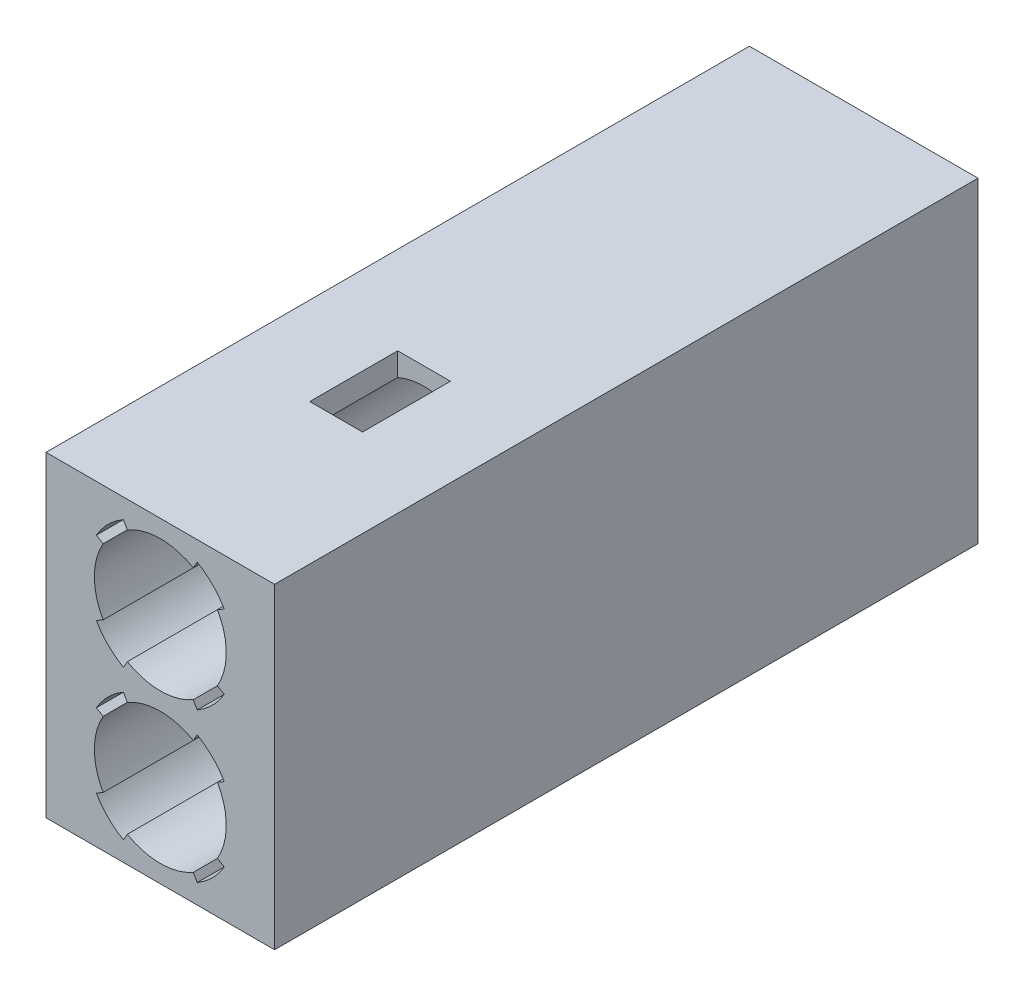
from build123d import *

# Parameters (mm, degrees)
SKETCH_1_W          = 130
SKETCH_1_H          = 180
EXTRUDE_1_DEPTH     = 400
SKETCH_2_R          = 37.5
CUT_EXTRUDE_1_DEPTH = 458.493169348
CUT_EXTRUDE_4_REACH = 459.493
SKETCH_11_W         = 30
SKETCH_11_H         = 50
CUT_EXTRUDE_9_DEPTH = 458.493169348


with BuildPart() as part:
    # 草圖1 → 填料-伸長1 (new body)
    with BuildSketch(Plane.XY):
        with Locations((-65, 90)):
            Rectangle(SKETCH_1_W, SKETCH_1_H)
    extrude(amount=EXTRUDE_1_DEPTH)

    # 草圖2 → 除料-伸長1 (cut, through all)
    with BuildSketch(Plane.XY.offset(400)):
        with Locations((-65, 132.5)):
            Circle(SKETCH_2_R)
        with Locations((-65, 47.5)):
            Circle(SKETCH_2_R)
    extrude(amount=-CUT_EXTRUDE_1_DEPTH, mode=Mode.SUBTRACT)

    # 草圖11 → 除料-伸長4 (cut, up to next)
    with BuildSketch(Plane(origin=(0, 180, 0), x_dir=(1, 0, 0), z_dir=(0, 1, 0)), mode=Mode.PRIVATE) as cut_extrude_4_sk1:
        with Locations((-65, -275)):
            Rectangle(SKETCH_11_W, SKETCH_11_H)
    cut_extrude_4_tool1 = extrude(cut_extrude_4_sk1.sketch, amount=-CUT_EXTRUDE_4_REACH, mode=Mode.PRIVATE) & part.part
    add(cut_extrude_4_tool1.solids().sort_by_distance((-65, 180, 275))[0], mode=Mode.SUBTRACT)

    # 草圖17 → 除料-伸長9 (cut, through all)
    with BuildSketch(Plane.XY.offset(400)):
        with BuildLine():
            Line((-44, 83.873066959), (-46.5, 79.54293994))
            ThreePointArc((-46.5, 79.54293994), (-38.837049096, 73.662950904), (-32.95706006, 66))
            Line((-32.95706006, 66), (-28.626933041, 68.5))
            ThreePointArc((-28.626933041, 68.5), (-35.30151519, 77.19848481), (-44, 83.873066959))
        make_face()
        with BuildLine():
            Line((-44, 168.873066959), (-46.5, 164.54293994))
            ThreePointArc((-46.5, 164.54293994), (-38.837049096, 158.662950904), (-32.95706006, 151))
            Line((-32.95706006, 151), (-28.626933041, 153.5))
            ThreePointArc((-28.626933041, 153.5), (-35.30151519, 162.19848481), (-44, 168.873066959))
        make_face()
        with BuildLine():
            Line((-28.626933041, 111.5), (-32.95706006, 114))
            ThreePointArc((-32.95706006, 114), (-38.837049096, 106.337049096), (-46.5, 100.45706006))
            Line((-46.5, 100.45706006), (-44, 96.126933041))
            ThreePointArc((-44, 96.126933041), (-35.30151519, 102.80151519), (-28.626933041, 111.5))
        make_face()
        with BuildLine():
            Line((-86, 96.126933041), (-83.5, 100.45706006))
            ThreePointArc((-83.5, 100.45706006), (-91.162950904, 106.337049096), (-97.04293994, 114))
            Line((-97.04293994, 114), (-101.373066959, 111.5))
            ThreePointArc((-101.373066959, 111.5), (-94.69848481, 102.80151519), (-86, 96.126933041))
        make_face()
        with BuildLine():
            Line((-101.373066959, 153.5), (-97.04293994, 151))
            ThreePointArc((-97.04293994, 151), (-91.162950904, 158.662950904), (-83.5, 164.54293994))
            Line((-83.5, 164.54293994), (-86, 168.873066959))
            ThreePointArc((-86, 168.873066959), (-94.69848481, 162.19848481), (-101.373066959, 153.5))
        make_face()
        with BuildLine():
            Line((-28.626933041, 26.5), (-32.95706006, 29))
            ThreePointArc((-32.95706006, 29), (-38.837049096, 21.337049096), (-46.5, 15.45706006))
            Line((-46.5, 15.45706006), (-44, 11.126933041))
            ThreePointArc((-44, 11.126933041), (-35.30151519, 17.80151519), (-28.626933041, 26.5))
        make_face()
        with BuildLine():
            Line((-86, 11.126933041), (-83.5, 15.45706006))
            ThreePointArc((-83.5, 15.45706006), (-91.162950904, 21.337049096), (-97.04293994, 29))
            Line((-97.04293994, 29), (-101.373066959, 26.5))
            ThreePointArc((-101.373066959, 26.5), (-94.69848481, 17.80151519), (-86, 11.126933041))
        make_face()
        with BuildLine():
            Line((-101.373066959, 68.5), (-97.04293994, 66))
            ThreePointArc((-97.04293994, 66), (-91.162950904, 73.662950904), (-83.5, 79.54293994))
            Line((-83.5, 79.54293994), (-86, 83.873066959))
            ThreePointArc((-86, 83.873066959), (-94.69848481, 77.19848481), (-101.373066959, 68.5))
        make_face()
    extrude(amount=-CUT_EXTRUDE_9_DEPTH, mode=Mode.SUBTRACT)


solid = part.part
